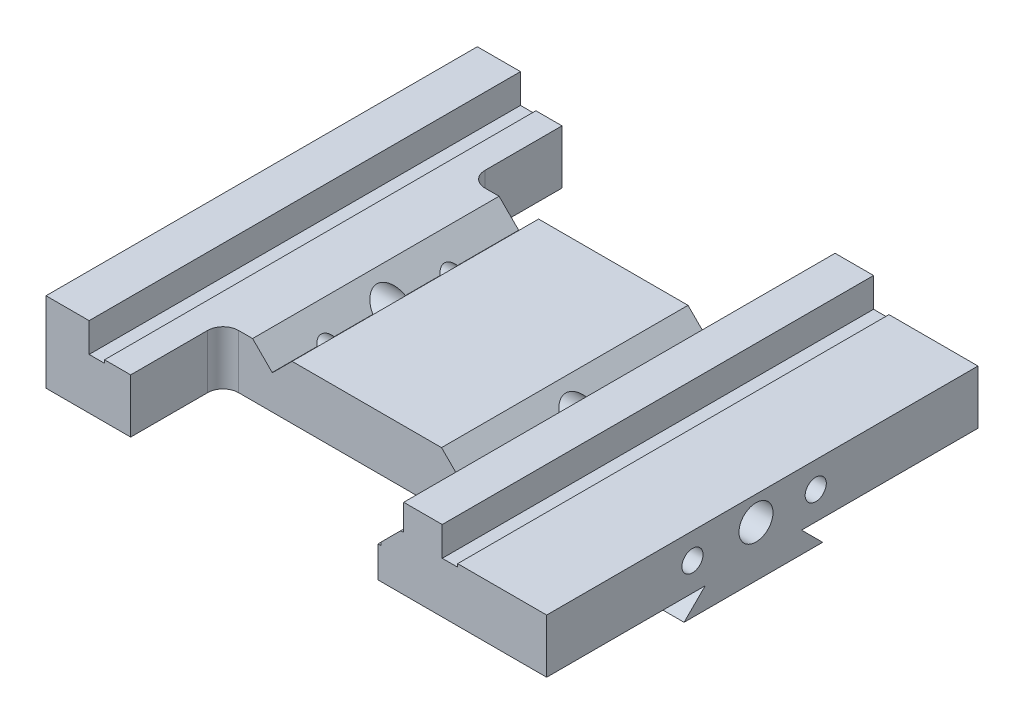
from build123d import *

# Parameters (mm, degrees)
BOSS_EXTRUDE1_DEPTH = 140
BOSS_EXTRUDE2_DEPTH = 162.5
CUT_EXTRUDE1_DEPTH  = 100
SKETCH4_R           = 5.519100576
CUT_EXTRUDE2_DEPTH  = 1000
SKETCH5_R           = 3.428433795
CUT_EXTRUDE3_DEPTH  = 1000


with BuildPart() as part:
    # Sketch1 → Boss-Extrude1 (new body)
    with BuildSketch(Plane.XY):
        Polygon((-148.823444479, 14.863961031), (-134.823444479, 14.863961031), (-134.823444479, 6.363961031), (-134.823444479, 5.363961031), (-129.823444479, 5.363961031), (-129.823444479, 6.363961031), (-111.771895875, 6.363961031), (-105.407934844, 0), (-105.307934844, 0), (-98.943973814, 6.363961031), (-50.443973814, 6.363961031), (-44.080012783, 0), (-44.080012783, -1), (-40.080012783, -1), (-40.080012783, 0), (-33.716051752, 6.363961031), (-32.716051752, 6.363961031), (-32.716051752, 14.863961031), (-20.216051752, 14.863961031), (-20.216051752, 5.363961031), (-15.216051752, 5.363961031), (-15.216051752, 6.363961031), (13.676555521, 6.363961031), (13.676555521, -11.136038969), (-148.823444479, -11.136038969), align=None)
    extrude(amount=BOSS_EXTRUDE1_DEPTH)

    # Sketch2 → Boss-Extrude2 (add)
    with BuildSketch(Plane(origin=(13.676555521, 0, 0), x_dir=(0, 0, -1), z_dir=(1, 0, 0))):
        Polygon((-88.54454788, -11.136038969), (-95.394820813, -17.986311902), (-50.409746992, -17.986311902), (-57.260019925, -11.136038969), align=None)
    extrude(amount=-BOSS_EXTRUDE2_DEPTH)

    # Sketch3 → Cut-Extrude1 (cut)
    with BuildSketch(Plane.XZ.offset(11.136038969)):
        with BuildLine():
            Line((-121.342924919, 0), (-41.039209534, 0))
            Line((-41.039209534, 0), (-41.039209534, 25))
            ThreePointArc((-41.039209534, 25), (-42.503675628, 28.535533906), (-46.039209534, 30))
            Line((-46.039209534, 30), (-116.342924919, 30))
            ThreePointArc((-116.342924919, 30), (-119.878458825, 28.535533906), (-121.342924919, 25))
            Line((-121.342924919, 25), (-121.342924919, 0))
        make_face()
        with BuildLine():
            Line((-121.342924919, 140), (-41.039209534, 140))
            Line((-41.039209534, 140), (-41.039209534, 115))
            ThreePointArc((-41.039209534, 115), (-42.503675628, 111.464466094), (-46.039209534, 110))
            Line((-46.039209534, 110), (-116.342924919, 110))
            ThreePointArc((-116.342924919, 110), (-119.878458825, 111.464466094), (-121.342924919, 115))
            Line((-121.342924919, 115), (-121.342924919, 140))
        make_face()
    extrude(amount=-CUT_EXTRUDE1_DEPTH, mode=Mode.SUBTRACT)

    # Sketch4 → Cut-Extrude2 (cut)
    with BuildSketch(Plane(origin=(13.676555521, 0, 0), x_dir=(0, 0, -1), z_dir=(1, 0, 0))):
        with Locations((-72.052487045, -1.555510128)):
            Circle(SKETCH4_R)
    extrude(amount=-CUT_EXTRUDE2_DEPTH, mode=Mode.SUBTRACT)

    # Sketch5 → Cut-Extrude3 (cut)
    with BuildSketch(Plane(origin=(13.676555521, 0, 0), x_dir=(0, 0, -1), z_dir=(1, 0, 0))):
        with Locations((-92.666596067, -2.001702964)):
            Circle(SKETCH5_R)
        with Locations((-52.666596067, -2.001702964)):
            Circle(SKETCH5_R)
    extrude(amount=-CUT_EXTRUDE3_DEPTH, mode=Mode.SUBTRACT)


solid = part.part
